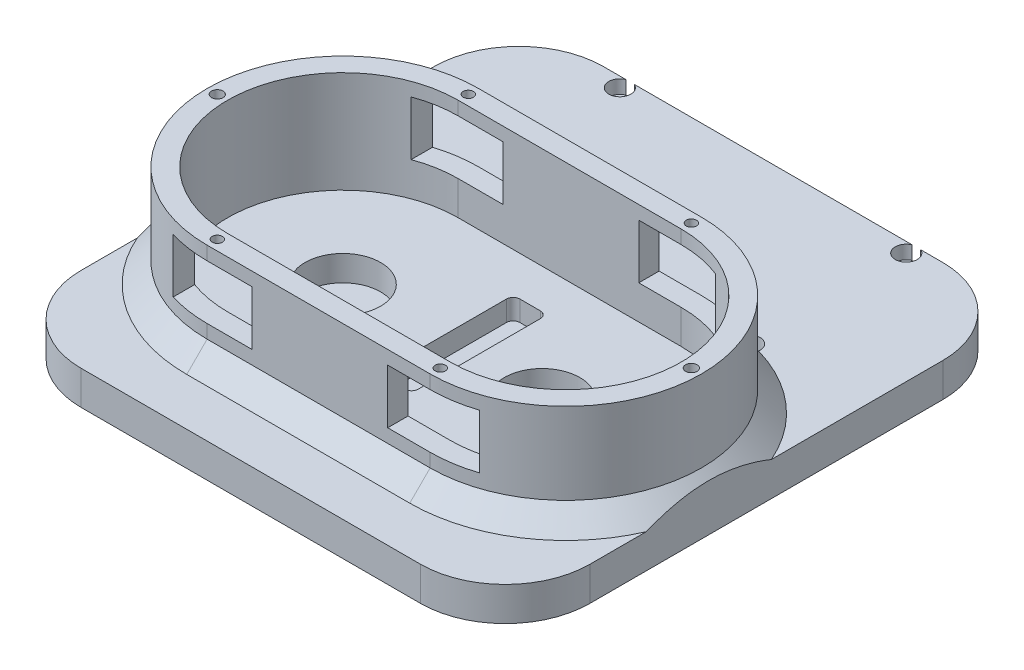
from build123d import *

# Parameters (mm, degrees)
BOSS_EXTRUDE1_DEPTH     = 10
BOSS_EXTRUDE2_START     = 10
BOSS_EXTRUDE2_DEPTH     = 30
SKETCH8_W               = 150
SKETCH8_H               = 154
BOSS_EXTRUDE3_DEPTH     = 10
CUT_EXTRUDE2_START      = 10
SKETCH5_R               = 11.15
CUT_EXTRUDE2_DEPTH      = 7.5
CUT_EXTRUDE4_DEPTH      = 135.270280498
CUT_EXTRUDE4_DEPTH_BACK = 135.270280498
SKETCH7_W               = 25
SKETCH7_H               = 16
CHAMFER1_SIZE           = 6
FILLET1_R               = 25
CUT_EXTRUDE5_START      = 40
SKETCH9_R               = 1.5
SKETCH9_R_2             = 1.7
CUT_EXTRUDE5_DEPTH      = 4
CUT_EXTRUDE6_DEPTH      = 176.297069285
CUT_EXTRUDE6_DEPTH_BACK = 176.297069285
SKETCH10_R              = 1.45
CUT_EXTRUDE7_DEPTH      = 135.270280563
CUT_EXTRUDE7_DEPTH_BACK = 4
CUT_EXTRUDE7_START      = 10
SKETCH11_R              = 3.25
CUT_EXTRUDE8_START      = 10
CUT_EXTRUDE8_DEPTH      = 6


with BuildPart() as part:
    # Sketch1 → Boss-Extrude1 (new body)
    with BuildSketch(Plane(origin=(0, 0, 0), x_dir=(1, 0, 0), z_dir=(0, 1, 0))):
        with BuildLine():
            Line((45, 40), (-20.73, 40))
            ThreePointArc((-20.73, 40), (-60.73, 0), (-20.73, -40))
            Line((-20.73, -40), (45, -40))
            ThreePointArc((45, -40), (85, 0), (45, 40))
        make_face()
    extrude(amount=BOSS_EXTRUDE1_DEPTH)

    # Sketch2 → Boss-Extrude2 (add)
    with BuildSketch(Plane(origin=(0, 0, 0), x_dir=(1, 0, 0), z_dir=(0, 1, 0)).offset(BOSS_EXTRUDE2_START)):
        with BuildLine():
            Line((-20.73, -40), (45, -40))
            ThreePointArc((45, -40), (85, 0), (45, 40))
            Line((45, 40), (-20.73, 40))
            ThreePointArc((-20.73, 40), (-60.73, 0), (-20.73, -40))
        make_face()
        with BuildLine():
            Line((45, 34), (-20.73, 34))
            ThreePointArc((-20.73, 34), (-54.73, 0), (-20.73, -34))
            Line((-20.73, -34), (45, -34))
            ThreePointArc((45, -34), (79, 0), (45, 34))
        make_face(mode=Mode.SUBTRACT)
    extrude(amount=BOSS_EXTRUDE2_DEPTH)

    # Sketch8 → Boss-Extrude3 (add)
    with BuildSketch(Plane(origin=(0, 0, 0), x_dir=(1, 0, 0), z_dir=(0, 1, 0))):
        with Locations((12.135, 17)):
            Rectangle(SKETCH8_W, SKETCH8_H)
    extrude(amount=BOSS_EXTRUDE3_DEPTH)

    # Sketch5 → Cut-Extrude2 (cut)
    with BuildSketch(Plane(origin=(0, 0, 0), x_dir=(1, 0, 0), z_dir=(0, 1, 0)).offset(CUT_EXTRUDE2_START)):
        with Locations(Location((-20.73, 0, 0), (0, 0, 270))):
            Circle(SKETCH5_R)
        with Locations(Location((38, 0, 0), (0, 0, 270))):
            Circle(SKETCH5_R)
    extrude(amount=-CUT_EXTRUDE2_DEPTH, mode=Mode.SUBTRACT)

    # Sketch7 → Cut-Extrude4 (cut, two sides: drawn at the far end of the back side and taken through both)
    with BuildSketch(Plane.XY.offset(-CUT_EXTRUDE4_DEPTH_BACK)):
        with Locations((-20, 28)):
            Rectangle(SKETCH7_W, SKETCH7_H)
        with Locations((45, 28)):
            Rectangle(SKETCH7_W, SKETCH7_H)
    extrude(amount=CUT_EXTRUDE4_DEPTH + CUT_EXTRUDE4_DEPTH_BACK, mode=Mode.SUBTRACT)

    # Chamfer1
    # the kernel refuses this chamfer: 6 mm, written as the material it adds along each edge
    with BuildSketch(Plane(origin=(-20.73, 10, 40), x_dir=(0, 0.9996219169112968, -0.02749587661058678), z_dir=(1, 0, 0))) as chamfer1_piece_1:
        Polygon((CHAMFER1_SIZE * 0.999621916911, CHAMFER1_SIZE * 0.0274958766106), (-CHAMFER1_SIZE * 0.0274958766106, CHAMFER1_SIZE * 0.999621916911), (0, 0), align=None)
    extrude(amount=65.73)
    with BuildSketch(Plane(origin=(45, 10, -40), x_dir=(0, -0.02749587661058648, -0.9996219169112968), z_dir=(-1, 0, 0))) as chamfer1_piece_2:
        Polygon((CHAMFER1_SIZE * 0.999621916911, -CHAMFER1_SIZE * 0.0274958766106), (-CHAMFER1_SIZE * 0.0274958766106, -CHAMFER1_SIZE * 0.999621916911), (0, 0), align=None)
    extrude(amount=65.73)
    with BuildSketch(Plane(origin=(45, 10, 0), x_dir=(0, 0, -1), z_dir=(-1, 0, 0))) as chamfer1_piece_3_section:
        Polygon((40 + CHAMFER1_SIZE, 0), (40, -CHAMFER1_SIZE), (40, 0), align=None)
    chamfer1_piece_3 = revolve(axis=Axis((45, 10, 0), (0, -1, 0)), revolution_arc=180, mode=Mode.PRIVATE)
    chamfer1_piece_3 = split(chamfer1_piece_3, bisect_by=Plane(origin=(87.135, 10.791585947, -38.986610485), z_dir=(-1, 0, 0)), keep=Keep.TOP, mode=Mode.PRIVATE)
    add(chamfer1_piece_3)
    with BuildSketch(Plane(origin=(-20.73, 10, 0), x_dir=(0, 0, 1), z_dir=(1, 0, 0))) as chamfer1_piece_4_section:
        Polygon((40, -CHAMFER1_SIZE), (40 + CHAMFER1_SIZE, 0), (40, 0), align=None)
    chamfer1_piece_4 = revolve(axis=Axis((-20.73, 10, 0), (0, -1, 0)), revolution_arc=180, mode=Mode.PRIVATE)
    chamfer1_piece_4 = split(chamfer1_piece_4, bisect_by=Plane(origin=(-62.865, 15.017860126, 35.326549698), z_dir=(1, 0, 0)), keep=Keep.TOP, mode=Mode.PRIVATE)
    add(chamfer1_piece_4)

    # Fillet1
    fillet1_edges = [part.edges().sort_by_distance(p)[0] for p in [
        (87.135, 5, 60),
        (87.135, 5, -94),
        (-62.865, 5, -94),
        (-62.865, 5, 60),
    ]]
    fillet(fillet1_edges, radius=FILLET1_R)

    # Sketch9 → Cut-Extrude5 (cut)
    with BuildSketch(Plane(origin=(0, 0, 0), x_dir=(1, 0, 0), z_dir=(0, 1, 0)).offset(CUT_EXTRUDE5_START)):
        with Locations(Location((45, -37, 0), (0, 0, 270))):
            Circle(SKETCH9_R)
        with Locations(Location((-20.73, -37, 0), (0, 0, 270))):
            Circle(SKETCH9_R)
        with Locations(Location((45, 37, 0), (0, 0, 270))):
            Circle(SKETCH9_R)
        with Locations(Location((-20.73, 37, 0), (0, 0, 270))):
            Circle(SKETCH9_R)
        with Locations(Location((-57.73, 0, 0), (0, 0, 270))):
            Circle(SKETCH9_R_2)
        with Locations(Location((82, 0, 0), (0, 0, 270))):
            Circle(SKETCH9_R_2)
    extrude(amount=-CUT_EXTRUDE5_DEPTH, mode=Mode.SUBTRACT)

    # Sketch10 → Cut-Extrude6 (cut, two sides: drawn at the far end of the back side and taken through both)
    with BuildSketch(Plane(origin=(-45.015, 10, -51.2), x_dir=(1, 0, 0), z_dir=(0, 1, 0)).offset(-CUT_EXTRUDE6_DEPTH_BACK)):
        with Locations(Location((14.94, -6.52, 0), (0, 0, 270))):
            Circle(SKETCH10_R)
        with Locations(Location((99.36, -6.52, 0), (0, 0, 270))):
            Circle(SKETCH10_R)
        with Locations(Location((99.36, 39.8, 0), (0, 0, 270))):
            Circle(SKETCH10_R)
        with Locations(Location((14.94, 39.8, 0), (0, 0, 270))):
            Circle(SKETCH10_R)
    extrude(amount=CUT_EXTRUDE6_DEPTH + CUT_EXTRUDE6_DEPTH_BACK, mode=Mode.SUBTRACT)

    # Sketch11 → Cut-Extrude7 (cut, two sides: drawn at the far end of the back side and taken through both)
    with BuildSketch(Plane(origin=(0, 0, 0), x_dir=(1, 0, 0), z_dir=(0, 1, 0)).offset(CUT_EXTRUDE7_START - CUT_EXTRUDE7_DEPTH_BACK)):
        with Locations(Location((-30.075, 44.68, 0), (0, 0, 90))):
            Circle(SKETCH11_R)
        with Locations((-30.075, 91)):
            Circle(SKETCH11_R)
        with Locations((54.345, 91)):
            Circle(SKETCH11_R)
        with Locations(Location((54.345, 44.68, 0), (0, 0, 90))):
            Circle(SKETCH11_R)
    extrude(amount=CUT_EXTRUDE7_DEPTH + CUT_EXTRUDE7_DEPTH_BACK, mode=Mode.SUBTRACT)

    # Sketch12 → Cut-Extrude8 (cut)
    with BuildSketch(Plane(origin=(0, 0, 0), x_dir=(1, 0, 0), z_dir=(0, 1, 0)).offset(CUT_EXTRUDE8_START)):
        with BuildLine():
            Line((15.135, 22.347672995), (9.135, 22.347672995))
            ThreePointArc((9.135, 22.347672995), (7.720786438, 21.761886557), (7.135, 20.347672995))
            Line((7.135, 20.347672995), (7.135, -15.652327005))
            ThreePointArc((7.135, -15.652327005), (7.720786438, -17.066540567), (9.135, -17.652327005))
            Line((9.135, -17.652327005), (15.135, -17.652327005))
            ThreePointArc((15.135, -17.652327005), (16.549213562, -17.066540567), (17.135, -15.652327005))
            Line((17.135, -15.652327005), (17.135, 20.347672995))
            ThreePointArc((17.135, 20.347672995), (16.549213562, 21.761886557), (15.135, 22.347672995))
        make_face()
    extrude(amount=-CUT_EXTRUDE8_DEPTH, mode=Mode.SUBTRACT)


solid = part.part
